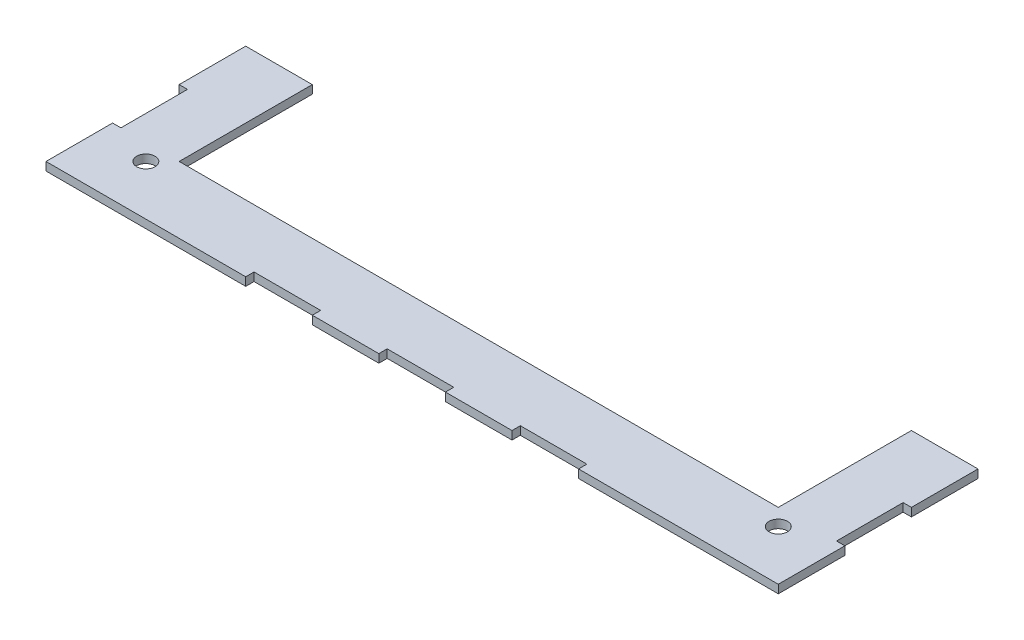
from build123d import *

# Parameters (mm, degrees)
SKETCH1_R           = 3.5
BOSS_EXTRUDE1_DEPTH = 3.175


with BuildPart() as part:
    # Sketch1 → Boss-Extrude1 (new body)
    with BuildSketch(Plane(origin=(0, 0, 0), x_dir=(1, 0, 0), z_dir=(0, 1, 0))):
        Polygon((-114.3, 63.5), (-139.7, 63.5), (-139.7, 38.1), (-136.525, 38.1), (-136.525, 12.7), (-139.7, 12.7), (-139.7, -12.7), (-63.5, -12.7), (-63.5, -9.525), (-38.1, -9.525), (-38.1, -12.7), (-12.7, -12.7), (-12.7, -9.525), (12.7, -9.525), (12.7, -12.7), (38.1, -12.7), (38.1, -9.525), (63.5, -9.525), (63.5, -12.7), (139.7, -12.7), (139.7, 12.7), (136.525, 12.7), (136.525, 38.1), (139.7, 38.1), (139.7, 63.5), (114.3, 63.5), (114.3, 12.7), (-114.3, 12.7), align=None)
        with Locations((-120.65, 6.35)):
            Circle(SKETCH1_R, mode=Mode.SUBTRACT)
        with Locations((120.65, 6.35)):
            Circle(SKETCH1_R, mode=Mode.SUBTRACT)
    extrude(amount=BOSS_EXTRUDE1_DEPTH)


solid = part.part
